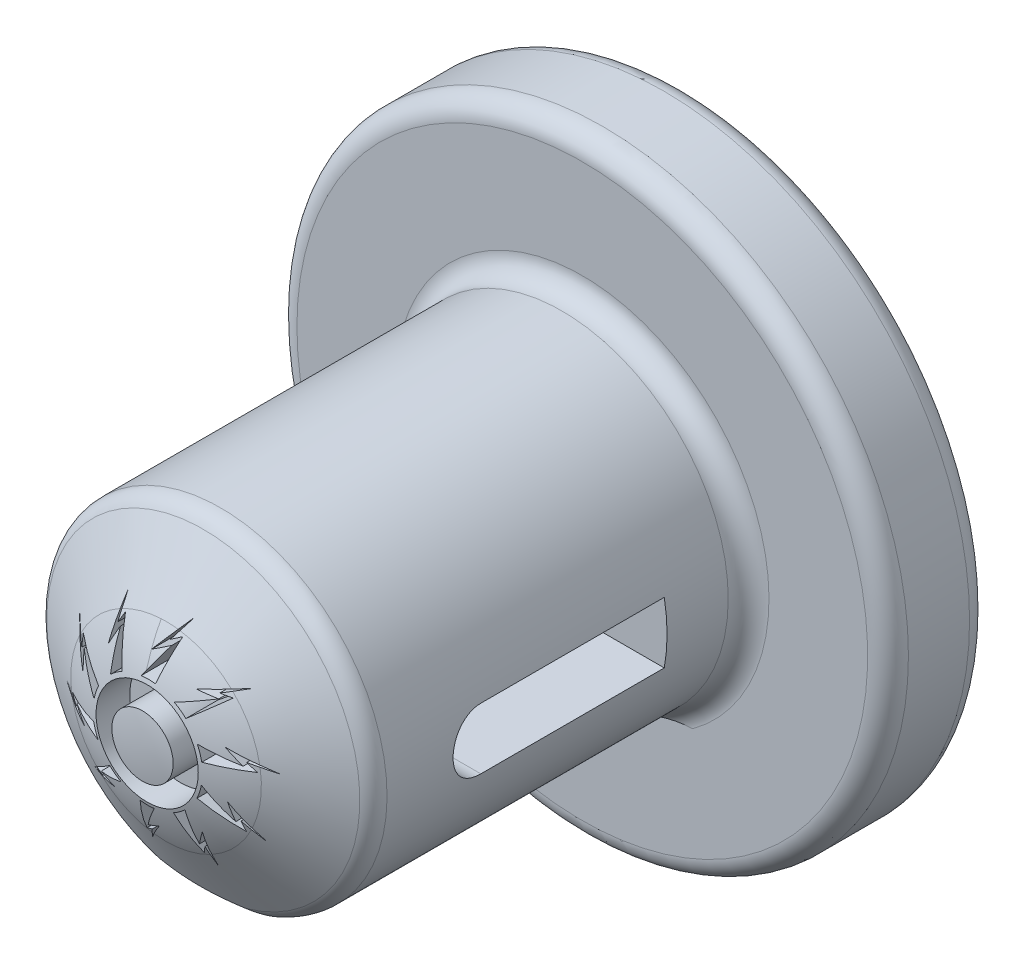
from build123d import *

# Parameters (mm, degrees)
SALIENTE_EXTRUIR1_DEPTH = 23.3
CROQUIS2_R              = 15
SALIENTE_EXTRUIR2_DEPTH = 5
CORTAR_EXTRUIR1_REACH   = 33.51
REDONDEO3_R             = 1
REDONDEO2_R             = 1
CROQUIS5_R              = 2.5
CROQUIS5_R_2            = 1.5
CORTAR_EXTRUIR2_DEPTH   = 2
CHAFL_N1_SIZE           = 0.5
CORTAR_EXTRUIR3_REACH   = 40.416


with BuildPart() as part:
    # Croquis1 → Saliente-Extruir1 (new body)
    with BuildSketch(Plane.XY):
        with BuildLine():
            Line((3.457987434, -7.391070485), (-3.457987434, -7.391070485))
            ThreePointArc((-3.457987434, -7.391070485), (0, 8.16), (3.457987434, -7.391070485))
        make_face()
        with BuildLine():
            Line((2.71, -4.391070485), (-2.71, -4.391070485))
            ThreePointArc((-2.71, -4.391070485), (0, 5.16), (2.71, -4.391070485))
        make_face(mode=Mode.SUBTRACT)
    extrude(amount=SALIENTE_EXTRUIR1_DEPTH)

    # Croquis2 → Saliente-Extruir2 (add)
    with BuildSketch(Plane(origin=(0, 0, 0), x_dir=(-1, 0, 0), z_dir=(0, 0, -1))):
        Circle(CROQUIS2_R)
        with BuildLine():
            Line((2.71, -4.391070485), (-2.71, -4.391070485))
            ThreePointArc((-2.71, -4.391070485), (0, 5.16), (2.71, -4.391070485))
        make_face(mode=Mode.SUBTRACT)
    extrude(amount=-SALIENTE_EXTRUIR2_DEPTH)

    # Croquis3 → Revolución1 (revolve)
    with BuildSketch(Plane(origin=(0, 0, 0), x_dir=(0, 0, -1), z_dir=(1, 0, 0))):
        with BuildLine():
            Line((-23.3, 0), (-23.3, 8.16))
            Line((-23.3, 8.16), (-25.418504626, 4.675672007))
            ThreePointArc((-25.418504626, 4.675672007), (-26.394722864, 2.427842124), (-26.728375155, 0))
            Line((-26.728375155, 0), (-23.3, 0))
        make_face()
    revolve(axis=Axis((0, 0, 26.728375155), (0, 0, -1)))

    # Croquis4 → Cortar-Extruir1 (cut, up to next)
    with BuildSketch(Plane(origin=(0, 0, 23.3), x_dir=(-1, 0, 0), z_dir=(0, 0, -1)), mode=Mode.PRIVATE) as cortar_extruir1_sk1:
        with BuildLine():
            Line((3.457987434, -7.391070485), (-3.457987434, -7.391070485))
            ThreePointArc((-3.457987434, -7.391070485), (0, -8.16), (3.457987434, -7.391070485))
        make_face()
    cortar_extruir1_tool1 = extrude(cortar_extruir1_sk1.sketch, amount=-CORTAR_EXTRUIR1_REACH, mode=Mode.PRIVATE) & part.part
    add(cortar_extruir1_tool1.solids().sort_by_distance((0, -7.699919, 23.3))[0], mode=Mode.SUBTRACT)

    # Redondeo3
    redondeo3_edges = [part.edges().sort_by_distance(p)[0] for p in [
        (15, 0, 0),
        (15, 0, 5),
        (0, 8.16, 5),
        (7.96544836, 1.771223426, 23.3),
    ]]
    fillet(redondeo3_edges, radius=REDONDEO3_R)

    # Redondeo2
    redondeo2_edges = [part.edges().sort_by_distance(p)[0] for p in [
        (0, -4.391070485, 0),
        (0, 5.16, 0),
    ]]
    fillet(redondeo2_edges, radius=REDONDEO2_R)

    # Croquis5 → Cortar-Extruir2 (cut)
    # profile 1 of 11: a face of its own
    with BuildSketch(Plane.XY.offset(26.728375155)):
        with Locations((0.025979011, -0.015198441)):
            Circle(CROQUIS5_R)
        with Locations((0.025979011, -0.015198441)):
            Circle(CROQUIS5_R_2, mode=Mode.SUBTRACT)
    # profile 2 of 11: a face of its own
    with BuildSketch(Plane.XY.offset(26.728375155)):
        with BuildLine():
            Line((1.302557766, 2.344074393), (2.881616708, 2.973814702))
            Line((2.881616708, 2.973814702), (1.998734761, 3.074340177))
            Line((1.998734761, 3.074340177), (3.892874702, 3.589350961))
            Line((3.892874702, 3.589350961), (2.860263918, 3.177538192))
            Line((2.860263918, 3.177538192), (3.350806324, 3.121684736))
            Line((3.350806324, 3.121684736), (1.868869662, 1.932624716))
            ThreePointArc((1.868869662, 1.932624716), (1.599104223, 2.156780008), (1.302557766, 2.344074393))
        make_face()
    # profile 3 of 11: a face of its own
    with BuildSketch(Plane.XY.offset(26.728375155)):
        with BuildLine():
            Line((-0.324020989, 2.662020265), (0.583312464, 4.099638436))
            Line((0.583312464, 4.099638436), (-0.190041428, 3.662020265))
            Line((-0.190041428, 3.662020265), (1.039634231, 5.192020265))
            Line((1.039634231, 5.192020265), (0.44629203, 4.251903346))
            Line((0.44629203, 4.251903346), (0.875979011, 4.495050543))
            Line((0.875979011, 4.495050543), (0.375979011, 2.662020265))
            ThreePointArc((0.375979011, 2.662020265), (0.025979011, 2.684801559), (-0.324020989, 2.662020265))
        make_face()
    # profile 4 of 11: a face of its own
    with BuildSketch(Plane.XY.offset(26.728375155)):
        with BuildLine():
            Line((2.431603727, 1.130771774), (4.079241313, 0.712094828))
            Line((4.079241313, 0.712094828), (3.424062205, 1.312366634))
            Line((3.424062205, 1.312366634), (5.259169351, 0.615671587))
            Line((5.259169351, 0.615671587), (4.181712206, 0.889461449))
            Line((4.181712206, 0.889461449), (4.545739511, 0.555941462))
            Line((4.545739511, 0.555941462), (2.647915623, 0.465032213))
            ThreePointArc((2.647915623, 0.465032213), (2.561425973, 0.804941801), (2.431603727, 1.130771774))
        make_face()
    # profile 5 of 11: a face of its own
    with BuildSketch(Plane.XY.offset(26.728375155)):
        with BuildLine():
            Line((2.631859712, -0.514447228), (3.718734384, -1.821621067))
            Line((3.718734384, -1.821621067), (3.541514267, -0.950886357))
            Line((3.541514267, -0.950886357), (4.61664006, -2.593173407))
            Line((4.61664006, -2.593173407), (3.905888563, -1.738359335))
            Line((3.905888563, -1.738359335), (4.004354709, -2.222152555))
            Line((4.004354709, -2.222152555), (2.415547816, -1.180186789))
            ThreePointArc((2.415547816, -1.180186789), (2.545370062, -0.854356816), (2.631859712, -0.514447228))
        make_face()
    # profile 6 of 11: a face of its own
    with BuildSketch(Plane.XY.offset(26.728375155)):
        with BuildLine():
            Line((1.82683474, -1.963164875), (1.937797316, -3.659539629))
            Line((1.937797316, -3.659539629), (2.30622825, -2.85093308))
            Line((2.30622825, -2.85093308), (2.210711181, -4.811514298))
            Line((2.210711181, -4.811514298), (2.138148245, -3.702185939))
            Line((2.138148245, -3.702185939), (1.933442511, -4.151459824))
            Line((1.933442511, -4.151459824), (1.260522844, -2.374614551))
            ThreePointArc((1.260522844, -2.374614551), (1.5570693, -2.187320167), (1.82683474, -1.963164875))
        make_face()
    # profile 7 of 11: a face of its own
    with BuildSketch(Plane.XY.offset(26.728375155)):
        with BuildLine():
            Line((0.324020989, -2.662020265), (-0.583312464, -4.099638436))
            Line((-0.583312464, -4.099638436), (0.190041428, -3.662020265))
            Line((0.190041428, -3.662020265), (-1.039634231, -5.192020265))
            Line((-1.039634231, -5.192020265), (-0.44629203, -4.251903346))
            Line((-0.44629203, -4.251903346), (-0.875979011, -4.495050543))
            Line((-0.875979011, -4.495050543), (-0.375979011, -2.662020265))
            ThreePointArc((-0.375979011, -2.662020265), (-0.025979011, -2.684801559), (0.324020989, -2.662020265))
        make_face()
    # profile 8 of 11: a face of its own
    with BuildSketch(Plane.XY.offset(26.728375155)):
        with BuildLine():
            Line((-1.302557766, -2.344074393), (-2.881616708, -2.973814702))
            Line((-2.881616708, -2.973814702), (-1.998734761, -3.074340177))
            Line((-1.998734761, -3.074340177), (-3.892874702, -3.589350961))
            Line((-3.892874702, -3.589350961), (-2.860263918, -3.177538192))
            Line((-2.860263918, -3.177538192), (-3.350806324, -3.121684736))
            Line((-3.350806324, -3.121684736), (-1.868869662, -1.932624716))
            ThreePointArc((-1.868869662, -1.932624716), (-1.599104223, -2.156780008), (-1.302557766, -2.344074393))
        make_face()
    # profile 9 of 11: a face of its own
    with BuildSketch(Plane.XY.offset(26.728375155)):
        with BuildLine():
            Line((-2.431603727, -1.130771774), (-4.079241313, -0.712094828))
            Line((-4.079241313, -0.712094828), (-3.424062205, -1.312366634))
            Line((-3.424062205, -1.312366634), (-5.259169351, -0.615671587))
            Line((-5.259169351, -0.615671587), (-4.181712206, -0.889461449))
            Line((-4.181712206, -0.889461449), (-4.545739511, -0.555941462))
            Line((-4.545739511, -0.555941462), (-2.647915623, -0.465032213))
            ThreePointArc((-2.647915623, -0.465032213), (-2.561425973, -0.804941801), (-2.431603727, -1.130771774))
        make_face()
    # profile 10 of 11: a face of its own
    with BuildSketch(Plane.XY.offset(26.728375155)):
        with BuildLine():
            Line((-2.631859712, 0.514447228), (-3.718734384, 1.821621067))
            Line((-3.718734384, 1.821621067), (-3.541514267, 0.950886357))
            Line((-3.541514267, 0.950886357), (-4.61664006, 2.593173407))
            Line((-4.61664006, 2.593173407), (-3.905888563, 1.738359335))
            Line((-3.905888563, 1.738359335), (-4.004354709, 2.222152555))
            Line((-4.004354709, 2.222152555), (-2.415547816, 1.180186789))
            ThreePointArc((-2.415547816, 1.180186789), (-2.545370062, 0.854356816), (-2.631859712, 0.514447228))
        make_face()
    # profile 11 of 11: a face of its own
    with BuildSketch(Plane.XY.offset(26.728375155)):
        with BuildLine():
            Line((-1.82683474, 1.963164875), (-1.937797316, 3.659539629))
            Line((-1.937797316, 3.659539629), (-2.30622825, 2.85093308))
            Line((-2.30622825, 2.85093308), (-2.210711181, 4.811514298))
            Line((-2.210711181, 4.811514298), (-2.138148245, 3.702185939))
            Line((-2.138148245, 3.702185939), (-1.933442511, 4.151459824))
            Line((-1.933442511, 4.151459824), (-1.260522844, 2.374614551))
            ThreePointArc((-1.260522844, 2.374614551), (-1.5570693, 2.187320167), (-1.82683474, 1.963164875))
        make_face()
    extrude(amount=-CORTAR_EXTRUIR2_DEPTH, mode=Mode.SUBTRACT)

    # Chaflán1
    chafl_n1_edges = [part.edges().sort_by_distance(p)[0] for p in [
        (0, 5.16, 23.3),
    ]]
    chamfer(chafl_n1_edges, length=CHAFL_N1_SIZE)

    # Croquis6 → Cortar-Extruir3 (cut, up to next)
    with BuildSketch(Plane(origin=(8.16, 0, 0), x_dir=(0, 0, -1), z_dir=(1, 0, 0)), mode=Mode.PRIVATE) as cortar_extruir3_sk1:
        with BuildLine():
            Line((-9, -1.5), (-9, 1.5))
            Line((-9, 1.5), (-18, 1.5))
            ThreePointArc((-18, 1.5), (-19.5, 0), (-18, -1.5))
            Line((-18, -1.5), (-9, -1.5))
        make_face()
    cortar_extruir3_tool1 = extrude(cortar_extruir3_sk1.sketch, amount=-CORTAR_EXTRUIR3_REACH, mode=Mode.PRIVATE) & part.part
    add(cortar_extruir3_tool1.solids().sort_by_distance((8.16, 0, 14.094555))[0], mode=Mode.SUBTRACT)


solid = part.part
